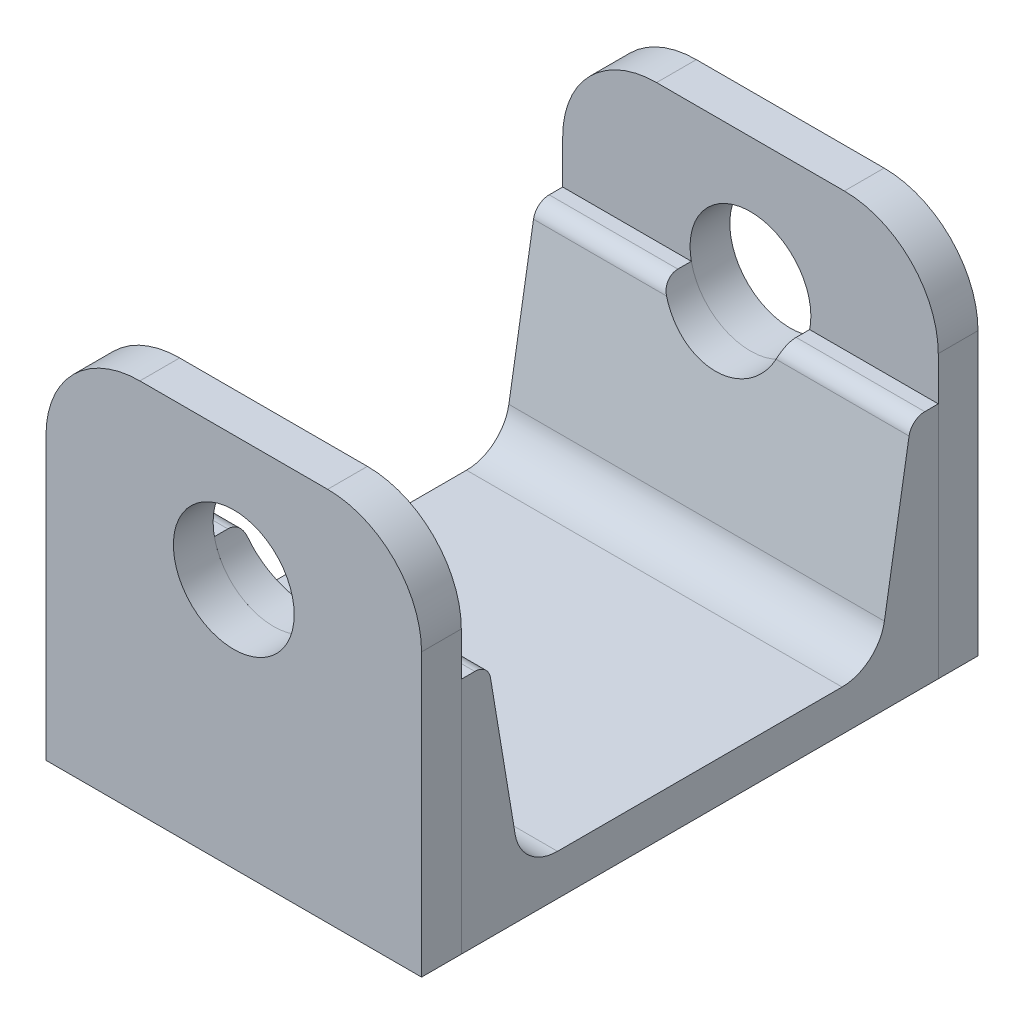
from build123d import *

# Parameters (mm, degrees)
MIEMBRO_ESTRUCTURAL1_DEPTH = 60
CROQUIS20_W                = 60
CROQUIS20_H                = 60
BRIDA_BASE2_DEPTH          = 6.35
CROQUIS19_W                = 60
CROQUIS19_H                = 60
BRIDA_BASE3_DEPTH          = 6.35
CORTAR_EXTRUIR1_DEPTH      = 111.153127737
CORTAR_EXTRUIR1_DEPTH_BACK = 111.153127737
CROQUIS4_R                 = 9.65
REDONDEO1_R                = 15
REDONDEO2_R                = 15


# Sheet-metal steps are written as plain solids
with BuildPart() as part:
    # Sketch1 → Miembro estructural1 (new body)
    with BuildSketch(Plane.YZ.offset(-18.536654135)):
        with BuildLine():
            Line((0, -38.1), (0, 38.1))
            Line((0, 38.1), (38.0492, 38.1))
            Line((38.0492, 38.1), (38.0492, 35.942335136))
            ThreePointArc((38.0492, 35.942335136), (37.447280466, 34.300554363), (35.926803066, 33.436899509))
            Line((35.926803066, 33.436899509), (12.283671721, 29.496090157))
            ThreePointArc((12.283671721, 29.496090157), (8.178382741, 27.164222052), (6.5532, 22.731413966))
            Line((6.5532, 22.731413966), (6.5532, -22.731413966))
            ThreePointArc((6.5532, -22.731413966), (8.178382741, -27.164222052), (12.283671721, -29.496090157))
            Line((12.283671721, -29.496090157), (35.926803066, -33.436899509))
            ThreePointArc((35.926803066, -33.436899509), (37.447280466, -34.300554363), (38.0492, -35.942335136))
            Line((38.0492, -35.942335136), (38.0492, -38.1))
            Line((38.0492, -38.1), (0, -38.1))
        make_face()
    extrude(amount=MIEMBRO_ESTRUCTURAL1_DEPTH)


with BuildPart() as body_2:
    # Croquis20 → Brida base2 (new body)
    with BuildSketch(Plane(origin=(0, 0, -38.1), x_dir=(-1, 0, 0), z_dir=(0, 0, -1))):
        with Locations((-11.463345865, 30)):
            Rectangle(CROQUIS20_W, CROQUIS20_H)
    extrude(amount=BRIDA_BASE2_DEPTH)


with BuildPart() as body_3:
    # Croquis19 → Brida base3 (new body)
    with BuildSketch(Plane.XY.offset(38.1)):
        with Locations((11.463345865, 30)):
            Rectangle(CROQUIS19_W, CROQUIS19_H)
    extrude(amount=BRIDA_BASE3_DEPTH)


with BuildPart() as cortar_extruir1_tool:
    # Croquis4 → Cortar-Extruir1 (new, two sides: drawn at the far end of the back side and taken through both)
    with BuildSketch(Plane.XY.offset(38.1).offset(-CORTAR_EXTRUIR1_DEPTH_BACK)):
        with Locations((11.463345865, 40)):
            Circle(CROQUIS4_R)
    extrude(amount=CORTAR_EXTRUIR1_DEPTH + CORTAR_EXTRUIR1_DEPTH_BACK)


with BuildPart() as part_1:
    add(part.part)

    # Cortar-Extruir1: cut by cortar_extruir1_tool
    add(cortar_extruir1_tool.part, mode=Mode.SUBTRACT)


with BuildPart() as body_2_1:
    add(body_2.part)

    # Cortar-Extruir1: cut by cortar_extruir1_tool
    add(cortar_extruir1_tool.part, mode=Mode.SUBTRACT)

    # Redondeo1
    redondeo1_edges = [body_2_1.edges().sort_by_distance(p)[0] for p in [
        (41.463345865, 60, -41.275),
        (-18.536654135, 60, -41.275),
    ]]
    fillet(redondeo1_edges, radius=REDONDEO1_R)


with BuildPart() as body_3_1:
    add(body_3.part)

    # Cortar-Extruir1: cut by cortar_extruir1_tool
    add(cortar_extruir1_tool.part, mode=Mode.SUBTRACT)

    # Redondeo2
    redondeo2_edges = [body_3_1.edges().sort_by_distance(p)[0] for p in [
        (-18.536654135, 60, 41.275),
        (41.463345865, 60, 41.275),
    ]]
    fillet(redondeo2_edges, radius=REDONDEO2_R)


solid = Compound([part_1.part, body_2_1.part, body_3_1.part])
